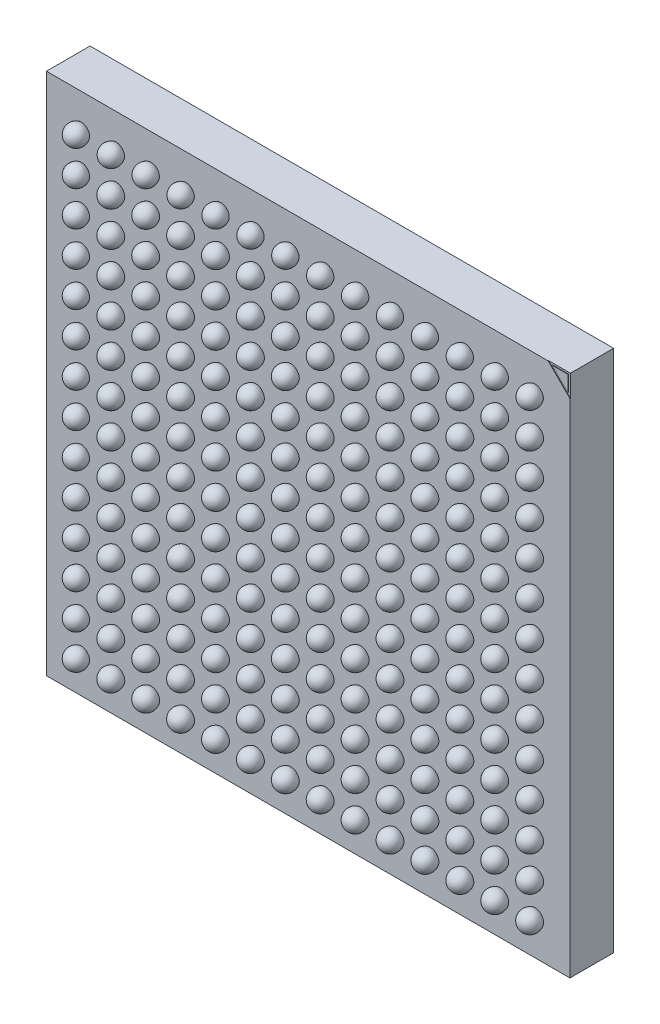
from build123d import *

# Parameters (mm, degrees)
SKETCH1_W            = 12
SKETCH1_H            = 12
BOSS_EXTRUDE1_DEPTH  = 1
LPATTERN1_COUNT      = 14
LPATTERN1_PITCH      = 0.8
LPATTERN2_COUNT      = 14
LPATTERN2_PITCH      = 0.8
LPATTERN3_COUNT      = 12
LPATTERN3_PITCH      = 0.8
LPATTERN4_COUNT      = 13
LPATTERN4_PITCH      = 0.8
LPATTERN5_COUNT      = 12
LPATTERN5_PITCH      = 0.8
LPATTERN6_COUNT      = 11
LPATTERN6_PITCH      = 0.8
LPATTERN7_COUNT      = 10
LPATTERN7_PITCH      = 0.8
LPATTERN7_COUNT_DIR2 = 10
LPATTERN7_PITCH_DIR2 = 0.8
BOSS_EXTRUDE2_DEPTH  = 0.01
BOSS_EXTRUDE3_DEPTH  = 0.01
CUT_EXTRUDE1_DEPTH   = 0.01
BOSS_EXTRUDE4_DEPTH  = 0.01


with BuildPart() as part:
    # Sketch1 → Boss-Extrude1 (new body)
    with BuildSketch(Plane.XY):
        Rectangle(SKETCH1_W, SKETCH1_H)
    extrude(amount=BOSS_EXTRUDE1_DEPTH)

    # Sketch3 → Revolve1 (revolve)
    with BuildSketch(Plane.XY.offset(1.12)):
        with BuildLine():
            Line((-5.2, 5.425), (-5.2, 4.975))
            ThreePointArc((-5.2, 4.975), (-5.425, 5.2), (-5.2, 5.425))
        make_face()
    revolve1 = revolve(axis=Axis((-5.2, 5.425, 1.12), (0, -1, 0)))

    # LPattern1: Revolve1 ×14
    with Locations(*[(i * LPATTERN1_PITCH, 0, 0) for i in range(1, LPATTERN1_COUNT)]):
        add(revolve1)

    # LPattern2: Revolve1 ×14
    with Locations(*[(0, -i * LPATTERN2_PITCH, 0) for i in range(1, LPATTERN2_COUNT)]):
        add(revolve1)

    # Sketch5 → Revolve2 (revolve)
    with BuildSketch(Plane.XY.offset(1.12)):
        with BuildLine():
            Line((5.2, 4.63), (5.2, 4.17))
            ThreePointArc((5.2, 4.17), (4.97, 4.4), (5.2, 4.63))
        make_face()
    revolve2 = revolve(axis=Axis((5.2, 5.2, 1.12), (0, -1, 0)))

    # LPattern3: Revolve2 ×12
    with Locations(*[(0, -i * LPATTERN3_PITCH, 0) for i in range(1, LPATTERN3_COUNT)]):
        add(revolve2)

    # Sketch8 → Revolve3 (revolve)
    with BuildSketch(Plane.XY.offset(1.12)):
        with BuildLine():
            Line((5.2, -4.972556486), (5.2, -5.432556486))
            ThreePointArc((5.2, -5.432556486), (5.43, -5.202556486), (5.2, -4.972556486))
        make_face()
    revolve3 = revolve(axis=Axis((5.2, -4.972556486, 1.12), (0, -1, 0)))

    # LPattern4: Revolve3 ×13
    with Locations(*[(-i * LPATTERN4_PITCH, 0, 0) for i in range(1, LPATTERN4_COUNT)]):
        add(revolve3)

    # Sketch9 → Revolve4 (revolve)
    with BuildSketch(Plane.XY.offset(1.12)):
        with BuildLine():
            Line((-4.4, 4.63), (-4.4, 4.17))
            ThreePointArc((-4.4, 4.17), (-4.17, 4.4), (-4.4, 4.63))
        make_face()
    revolve4 = revolve(axis=Axis((-4.4, 4.63, 1.12), (0, -1, 0)))

    # LPattern5: Revolve4 ×12
    with Locations(*[(i * LPATTERN5_PITCH, 0, 0) for i in range(1, LPATTERN5_COUNT)]):
        add(revolve4)

    # Mirror3: Revolve4 across plane
    add(revolve4.mirror(Plane.ZX))

    # Mirror3 copy 1 sketch → Mirror3 copy 1 (revolve)
    with BuildSketch(Plane(origin=(0.8, 0, 1.12), x_dir=(1, 0, 0), z_dir=(0, 0, 1))):
        with BuildLine():
            Line((-4.4, -4.63), (-4.4, -4.17))
            ThreePointArc((-4.4, -4.17), (-4.17, -4.4), (-4.4, -4.63))
        make_face()
    revolve(axis=Axis((-3.6, -4.63, 1.12), (0, -1, 0)))

    # Mirror3 copy 2 sketch → Mirror3 copy 2 (revolve)
    with BuildSketch(Plane(origin=(1.6, 0, 1.12), x_dir=(1, 0, 0), z_dir=(0, 0, 1))):
        with BuildLine():
            Line((-4.4, -4.63), (-4.4, -4.17))
            ThreePointArc((-4.4, -4.17), (-4.17, -4.4), (-4.4, -4.63))
        make_face()
    revolve(axis=Axis((-2.8, -4.63, 1.12), (0, -1, 0)))

    # Mirror3 copy 3 sketch → Mirror3 copy 3 (revolve)
    with BuildSketch(Plane(origin=(2.4, 0, 1.12), x_dir=(1, 0, 0), z_dir=(0, 0, 1))):
        with BuildLine():
            Line((-4.4, -4.63), (-4.4, -4.17))
            ThreePointArc((-4.4, -4.17), (-4.17, -4.4), (-4.4, -4.63))
        make_face()
    revolve(axis=Axis((-2, -4.63, 1.12), (0, -1, 0)))

    # Mirror3 copy 4 sketch → Mirror3 copy 4 (revolve)
    with BuildSketch(Plane(origin=(3.2, 0, 1.12), x_dir=(1, 0, 0), z_dir=(0, 0, 1))):
        with BuildLine():
            Line((-4.4, -4.63), (-4.4, -4.17))
            ThreePointArc((-4.4, -4.17), (-4.17, -4.4), (-4.4, -4.63))
        make_face()
    revolve(axis=Axis((-1.2, -4.63, 1.12), (0, -1, 0)))

    # Mirror3 copy 5 sketch → Mirror3 copy 5 (revolve)
    with BuildSketch(Plane(origin=(4, 0, 1.12), x_dir=(1, 0, 0), z_dir=(0, 0, 1))):
        with BuildLine():
            Line((-4.4, -4.63), (-4.4, -4.17))
            ThreePointArc((-4.4, -4.17), (-4.17, -4.4), (-4.4, -4.63))
        make_face()
    revolve(axis=Axis((-0.4, -4.63, 1.12), (0, -1, 0)))

    # Mirror3 copy 6 sketch → Mirror3 copy 6 (revolve)
    with BuildSketch(Plane(origin=(4.8, 0, 1.12), x_dir=(1, 0, 0), z_dir=(0, 0, 1))):
        with BuildLine():
            Line((-4.4, -4.63), (-4.4, -4.17))
            ThreePointArc((-4.4, -4.17), (-4.17, -4.4), (-4.4, -4.63))
        make_face()
    revolve(axis=Axis((0.4, -4.63, 1.12), (0, -1, 0)))

    # Mirror3 copy 7 sketch → Mirror3 copy 7 (revolve)
    with BuildSketch(Plane(origin=(5.6, 0, 1.12), x_dir=(1, 0, 0), z_dir=(0, 0, 1))):
        with BuildLine():
            Line((-4.4, -4.63), (-4.4, -4.17))
            ThreePointArc((-4.4, -4.17), (-4.17, -4.4), (-4.4, -4.63))
        make_face()
    revolve(axis=Axis((1.2, -4.63, 1.12), (0, -1, 0)))

    # Mirror3 copy 8 sketch → Mirror3 copy 8 (revolve)
    with BuildSketch(Plane(origin=(6.4, 0, 1.12), x_dir=(1, 0, 0), z_dir=(0, 0, 1))):
        with BuildLine():
            Line((-4.4, -4.63), (-4.4, -4.17))
            ThreePointArc((-4.4, -4.17), (-4.17, -4.4), (-4.4, -4.63))
        make_face()
    revolve(axis=Axis((2, -4.63, 1.12), (0, -1, 0)))

    # Mirror3 copy 9 sketch → Mirror3 copy 9 (revolve)
    with BuildSketch(Plane(origin=(7.2, 0, 1.12), x_dir=(1, 0, 0), z_dir=(0, 0, 1))):
        with BuildLine():
            Line((-4.4, -4.63), (-4.4, -4.17))
            ThreePointArc((-4.4, -4.17), (-4.17, -4.4), (-4.4, -4.63))
        make_face()
    revolve(axis=Axis((2.8, -4.63, 1.12), (0, -1, 0)))

    # Mirror3 copy 10 sketch → Mirror3 copy 10 (revolve)
    with BuildSketch(Plane(origin=(8, 0, 1.12), x_dir=(1, 0, 0), z_dir=(0, 0, 1))):
        with BuildLine():
            Line((-4.4, -4.63), (-4.4, -4.17))
            ThreePointArc((-4.4, -4.17), (-4.17, -4.4), (-4.4, -4.63))
        make_face()
    revolve(axis=Axis((3.6, -4.63, 1.12), (0, -1, 0)))

    # Mirror3 copy 11 sketch → Mirror3 copy 11 (revolve)
    with BuildSketch(Plane(origin=(8.8, 0, 1.12), x_dir=(1, 0, 0), z_dir=(0, 0, 1))):
        with BuildLine():
            Line((-4.4, -4.63), (-4.4, -4.17))
            ThreePointArc((-4.4, -4.17), (-4.17, -4.4), (-4.4, -4.63))
        make_face()
    revolve(axis=Axis((4.4, -4.63, 1.12), (0, -1, 0)))

    # LPattern6: Revolve4 ×11
    with Locations(*[(0, -i * LPATTERN6_PITCH, 0) for i in range(1, LPATTERN6_COUNT)]):
        add(revolve4)

    # Mirror4 copy 1 sketch → Mirror4 copy 1 (revolve)
    with BuildSketch(Plane(origin=(0, -0.8, 1.12), x_dir=(-1, 0, 0), z_dir=(0, 0, 1))):
        with BuildLine():
            Line((-4.4, -4.63), (-4.4, -4.17))
            ThreePointArc((-4.4, -4.17), (-4.17, -4.4), (-4.4, -4.63))
        make_face()
    revolve(axis=Axis((4.4, 3.83, 1.12), (0, 1, 0)))

    # Mirror4 copy 2 sketch → Mirror4 copy 2 (revolve)
    with BuildSketch(Plane(origin=(0, -1.6, 1.12), x_dir=(-1, 0, 0), z_dir=(0, 0, 1))):
        with BuildLine():
            Line((-4.4, -4.63), (-4.4, -4.17))
            ThreePointArc((-4.4, -4.17), (-4.17, -4.4), (-4.4, -4.63))
        make_face()
    revolve(axis=Axis((4.4, 3.03, 1.12), (0, 1, 0)))

    # Mirror4 copy 3 sketch → Mirror4 copy 3 (revolve)
    with BuildSketch(Plane(origin=(0, -2.4, 1.12), x_dir=(-1, 0, 0), z_dir=(0, 0, 1))):
        with BuildLine():
            Line((-4.4, -4.63), (-4.4, -4.17))
            ThreePointArc((-4.4, -4.17), (-4.17, -4.4), (-4.4, -4.63))
        make_face()
    revolve(axis=Axis((4.4, 2.23, 1.12), (0, 1, 0)))

    # Mirror4 copy 4 sketch → Mirror4 copy 4 (revolve)
    with BuildSketch(Plane(origin=(0, -3.2, 1.12), x_dir=(-1, 0, 0), z_dir=(0, 0, 1))):
        with BuildLine():
            Line((-4.4, -4.63), (-4.4, -4.17))
            ThreePointArc((-4.4, -4.17), (-4.17, -4.4), (-4.4, -4.63))
        make_face()
    revolve(axis=Axis((4.4, 1.43, 1.12), (0, 1, 0)))

    # Mirror4 copy 5 sketch → Mirror4 copy 5 (revolve)
    with BuildSketch(Plane(origin=(0, -4, 1.12), x_dir=(-1, 0, 0), z_dir=(0, 0, 1))):
        with BuildLine():
            Line((-4.4, -4.63), (-4.4, -4.17))
            ThreePointArc((-4.4, -4.17), (-4.17, -4.4), (-4.4, -4.63))
        make_face()
    revolve(axis=Axis((4.4, 0.63, 1.12), (0, 1, 0)))

    # Mirror4 copy 6 sketch → Mirror4 copy 6 (revolve)
    with BuildSketch(Plane(origin=(0, -4.8, 1.12), x_dir=(-1, 0, 0), z_dir=(0, 0, 1))):
        with BuildLine():
            Line((-4.4, -4.63), (-4.4, -4.17))
            ThreePointArc((-4.4, -4.17), (-4.17, -4.4), (-4.4, -4.63))
        make_face()
    revolve(axis=Axis((4.4, -0.17, 1.12), (0, 1, 0)))

    # Mirror4 copy 7 sketch → Mirror4 copy 7 (revolve)
    with BuildSketch(Plane(origin=(0, -5.6, 1.12), x_dir=(-1, 0, 0), z_dir=(0, 0, 1))):
        with BuildLine():
            Line((-4.4, -4.63), (-4.4, -4.17))
            ThreePointArc((-4.4, -4.17), (-4.17, -4.4), (-4.4, -4.63))
        make_face()
    revolve(axis=Axis((4.4, -0.97, 1.12), (0, 1, 0)))

    # Mirror4 copy 8 sketch → Mirror4 copy 8 (revolve)
    with BuildSketch(Plane(origin=(0, -6.4, 1.12), x_dir=(-1, 0, 0), z_dir=(0, 0, 1))):
        with BuildLine():
            Line((-4.4, -4.63), (-4.4, -4.17))
            ThreePointArc((-4.4, -4.17), (-4.17, -4.4), (-4.4, -4.63))
        make_face()
    revolve(axis=Axis((4.4, -1.77, 1.12), (0, 1, 0)))

    # Mirror4 copy 9 sketch → Mirror4 copy 9 (revolve)
    with BuildSketch(Plane(origin=(0, -7.2, 1.12), x_dir=(-1, 0, 0), z_dir=(0, 0, 1))):
        with BuildLine():
            Line((-4.4, -4.63), (-4.4, -4.17))
            ThreePointArc((-4.4, -4.17), (-4.17, -4.4), (-4.4, -4.63))
        make_face()
    revolve(axis=Axis((4.4, -2.57, 1.12), (0, 1, 0)))

    # Mirror4 copy 10 sketch → Mirror4 copy 10 (revolve)
    with BuildSketch(Plane(origin=(0, -8, 1.12), x_dir=(-1, 0, 0), z_dir=(0, 0, 1))):
        with BuildLine():
            Line((-4.4, -4.63), (-4.4, -4.17))
            ThreePointArc((-4.4, -4.17), (-4.17, -4.4), (-4.4, -4.63))
        make_face()
    revolve(axis=Axis((4.4, -3.37, 1.12), (0, 1, 0)))

    # Mirror4 copy 11 sketch → Mirror4 copy 11 (revolve)
    with BuildSketch(Plane(origin=(0, 0, 1.12), x_dir=(-1, 0, 0), z_dir=(0, 0, 1))):
        with BuildLine():
            Line((-4.4, -4.63), (-4.4, -4.17))
            ThreePointArc((-4.4, -4.17), (-4.17, -4.4), (-4.4, -4.63))
        make_face()
    revolve(axis=Axis((4.4, 4.63, 1.12), (0, 1, 0)))

    # Sketch10 → Revolve5 (revolve)
    with BuildSketch(Plane.XY.offset(1.12)):
        with BuildLine():
            Line((-3.6, 3.83), (-3.6, 3.37))
            ThreePointArc((-3.6, 3.37), (-3.83, 3.6), (-3.6, 3.83))
        make_face()
    revolve5 = revolve(axis=Axis((-3.6, 3.83, 1.12), (0, -1, 0)))

    # LPattern7: Revolve5 10 × 10
    with Locations(*[(i * LPATTERN7_PITCH, -j * LPATTERN7_PITCH_DIR2, 0) for i in range(LPATTERN7_COUNT) for j in range(LPATTERN7_COUNT_DIR2) if (i, j) != (0, 0)]):
        add(revolve5)

    # Sketch11 → Boss-Extrude2 (add)
    # profile 1 of 2: a face of its own
    with BuildSketch(Plane(origin=(0, 0, 0), x_dir=(-1, 0, 0), z_dir=(0, 0, -1))):
        with BuildLine():
            Line((-4.383850212, 0.87976633), (-4.383850212, 4.310264847))
            Line((-4.383850212, 4.310264847), (-3.29335538, 4.310264847))
            Line((-3.29335538, 4.310264847), (-1.699193609, 2.507481058))
            Line((-1.699193609, 2.507481058), (-1.699193609, 4.310264847))
            Line((-1.699193609, 4.310264847), (-0.340536036, 4.310264847))
            Line((-0.340536036, 4.310264847), (0.283707933, 3.303879896))
            Line((0.283707933, 3.303879896), (0.905288203, 4.310264847))
            Line((0.905288203, 4.310264847), (3.996249009, 4.310264847))
            ThreePointArc((3.996249009, 4.310264847), (4.420513078, 4.134528915), (4.596249009, 3.710264847))
            Line((4.596249009, 3.710264847), (4.596249009, 2.778053424))
            ThreePointArc((4.596249009, 2.778053424), (4.420513078, 2.353789355), (3.996249009, 2.178053424))
            Line((3.996249009, 2.178053424), (2.328850088, 2.178053424))
            Line((2.328850088, 2.178053424), (2.328850088, 0.844626446))
            Line((2.328850088, 0.844626446), (0.905288203, 0.844626446))
            Line((0.905288203, 0.844626446), (0.283707933, 1.846717072))
            Line((0.283707933, 1.846717072), (-0.324294808, 0.862315154))
            Line((-0.324294808, 0.862315154), (-1.585887652, 0.862315154))
            Line((-1.585887652, 0.862315154), (-3.219751476, 2.709996656))
            Line((-3.219751476, 2.709996656), (-3.219751476, 0.87976633))
            Line((-3.219751476, 0.87976633), (-4.383850212, 0.87976633))
        make_face()
        Polygon((-4.219704391, 1.045144765), (-4.219704391, 4.114773531), (-3.322697893, 4.114773531), (-1.495738313, 1.992381752), (-1.495738313, 3.900233946), (-0.680566666, 2.594058204), (-1.59427424, 1.073528346), (-3.375117038, 3.142345934), (-3.375117038, 1.045144765), align=None, mode=Mode.SUBTRACT)
        Polygon((-1.445224228, 4.150363705), (-0.430793897, 4.150363705), (0.294524128, 2.989356236), (0.990555559, 4.150363705), (2.003154175, 4.150363705), (1.060414542, 2.577837373), (2.035310731, 1.017333266), (1.029352181, 1.017333266), (0.294524128, 2.193563318), (-0.404596433, 1.027403062), (-1.445224228, 1.027403062), (-0.458796817, 2.594058204), align=None, mode=Mode.SUBTRACT)
        with BuildLine():
            Line((2.21981642, 4.150363705), (3.859234326, 4.127386313))
            ThreePointArc((3.859234326, 4.127386313), (4.280993931, 3.945721917), (4.450766882, 3.519036714))
            Line((4.450766882, 3.519036714), (4.442189322, 2.907034951))
            ThreePointArc((4.442189322, 2.907034951), (4.263528963, 2.488216886), (3.842248245, 2.315443472))
            Line((3.842248245, 2.315443472), (2.152608039, 2.315443472))
            Line((2.152608039, 2.315443472), (2.152608039, 1.109618447))
            Line((2.152608039, 1.109618447), (1.267354651, 2.577837373))
            Line((1.267354651, 2.577837373), (2.21981642, 4.150363705))
        make_face(mode=Mode.SUBTRACT)
    # profile 2 of 2: a face of its own
    with BuildSketch(Plane(origin=(0, 0, 0), x_dir=(-1, 0, 0), z_dir=(0, 0, -1))):
        with BuildLine():
            Line((2.152608039, 3.693985443), (3.707065203, 3.693985443))
            ThreePointArc((3.707065203, 3.693985443), (3.848486559, 3.635406799), (3.907065203, 3.493985443))
            Line((3.907065203, 3.493985443), (3.907065203, 2.978053424))
            ThreePointArc((3.907065203, 2.978053424), (3.848486559, 2.836632068), (3.707065203, 2.778053424))
            Line((3.707065203, 2.778053424), (2.152608039, 2.778053424))
            Line((2.152608039, 2.778053424), (2.152608039, 3.693985443))
        make_face()
        with BuildLine():
            Line((2.313280362, 3.527993081), (3.520235623, 3.527993081))
            ThreePointArc((3.520235623, 3.527993081), (3.661656979, 3.469414438), (3.720235623, 3.327993081))
            Line((3.720235623, 3.327993081), (3.720235623, 3.154921786))
            ThreePointArc((3.720235623, 3.154921786), (3.661656979, 3.01350043), (3.520235623, 2.954921786))
            Line((3.520235623, 2.954921786), (2.313280362, 2.954921786))
            Line((2.313280362, 2.954921786), (2.313280362, 3.527993081))
        make_face(mode=Mode.SUBTRACT)
    extrude(amount=BOSS_EXTRUDE2_DEPTH)

    # Sketch12 → Boss-Extrude3 (add)
    # profile 1 of 7: a face of its own
    with BuildSketch(Plane(origin=(0, 0, 0), x_dir=(-1, 0, 0), z_dir=(0, 0, -1))):
        with BuildLine():
            Line((-2.389935631, -3.291769219), (-2.550993323, -3.439124989))
            add(Edge.make_bspline(
                [(-2.550993323, -3.439124989), (-2.557892344, -3.429393202), (-2.571137502, -3.41070953), (-2.592606522, -3.385691652), (-2.613978598, -3.36434954), (-2.63545173, -3.346772353), (-2.657216247, -3.333066883), (-2.679234369, -3.323363259), (-2.70138127, -3.317194573), (-2.716260569, -3.316426423), (-2.723589477, -3.316048066)],
                knots=[0, 0, 0, 0, 1.299362458, 2.494594718, 3.587462134, 4.587049575, 5.512617175, 6.380583204, 7.202344345, 8, 8, 8, 8], degree=3))
            add(Edge.make_bspline(
                [(-2.723589477, -3.316048066), (-2.730425672, -3.31628781), (-2.743624569, -3.316750695), (-2.762440575, -3.321351731), (-2.779145694, -3.329292444), (-2.793723621, -3.339675594), (-2.80527149, -3.352184882), (-2.814491568, -3.36530391), (-2.819683247, -3.379784349), (-2.820366574, -3.389730099), (-2.820704861, -3.394653835)],
                knots=[0, 0, 0, 0, 1.185010067, 2.2879431, 3.333075148, 4.379039566, 5.372662701, 6.27520591, 7.14612461, 8, 8, 8, 8], degree=3))
            add(Edge.make_bspline(
                [(-2.820704861, -3.394653835), (-2.820492874, -3.399648573), (-2.82006596, -3.409707283), (-2.815942557, -3.424449574), (-2.80972741, -3.438854509), (-2.803788584, -3.447623478), (-2.800752938, -3.452105758)],
                knots=[0, 0, 0, 0, 0.967525499, 1.948461899, 2.951351359, 4, 4, 4, 4], degree=3))
            add(Edge.make_bspline(
                [(-2.800752938, -3.452105758), (-2.797993208, -3.455589787), (-2.791640674, -3.463609562), (-2.779527693, -3.476311635), (-2.764316332, -3.491872787), (-2.745421227, -3.509757915), (-2.723626765, -3.530610238), (-2.697922745, -3.553610043), (-2.66904904, -3.579469608), (-2.64852628, -3.597477272), (-2.637772169, -3.60691345)],
                knots=[0, 0, 0, 0, 0.473873513, 1.090794244, 1.870441696, 2.795289791, 3.865433203, 5.087734844, 6.473946851, 8, 8, 8, 8], degree=3))
            add(Edge.make_bspline(
                [(-2.637772169, -3.60691345), (-2.627677889, -3.61564954), (-2.608521042, -3.632228825), (-2.581264654, -3.655760457), (-2.557310828, -3.676931293), (-2.536310612, -3.695423603), (-2.518582349, -3.711431415), (-2.504051508, -3.725031245), (-2.492540622, -3.73595833), (-2.485997356, -3.742558295), (-2.483204861, -3.745374989)],
                knots=[0, 0, 0, 0, 1.543621617, 2.929473131, 4.163658386, 5.240097082, 6.164993805, 6.925417477, 7.541396219, 8, 8, 8, 8], degree=3))
            add(Edge.make_bspline(
                [(-2.483204861, -3.745374989), (-2.472610718, -3.756840121), (-2.452245054, -3.778880131), (-2.425776871, -3.813035214), (-2.4039927, -3.846377541), (-2.387140052, -3.879534499), (-2.374412254, -3.912984479), (-2.365438988, -3.947547839), (-2.360064839, -3.983585745), (-2.359468183, -4.008177216), (-2.3591664, -4.020615373)],
                knots=[0, 0, 0, 0, 1.206664779, 2.319633467, 3.337109185, 4.282041471, 5.190008762, 6.099243693, 7.03861361, 8, 8, 8, 8], degree=3))
            add(Edge.make_bspline(
                [(-2.3591664, -4.020615373), (-2.359381202, -4.032734832), (-2.359802651, -4.056513661), (-2.364964594, -4.091310436), (-2.372325222, -4.124612459), (-2.383706044, -4.156057358), (-2.397576923, -4.186161292), (-2.414966073, -4.214455336), (-2.435387245, -4.241225838), (-2.458793044, -4.265994243), (-2.484682636, -4.288469853), (-2.512451685, -4.308478172), (-2.542371729, -4.324997588), (-2.574187137, -4.338600149), (-2.607880878, -4.349077024), (-2.643412814, -4.35682041), (-2.680837292, -4.361467869), (-2.706428689, -4.361953705), (-2.719502938, -4.362201912)],
                knots=[0, 0, 0, 0, 1.043214005, 2.046824704, 3.02475056, 3.976699089, 4.921714032, 5.875962561, 6.831408892, 7.817874052, 8.806269674, 9.781291748, 10.760897367, 11.74438705, 12.757449933, 13.795994037, 14.874007457, 16, 16, 16, 16], degree=3))
            add(Edge.make_bspline(
                [(-2.719502938, -4.362201912), (-2.729766112, -4.362019836), (-2.750093083, -4.361659222), (-2.780051965, -4.358715109), (-2.808980652, -4.353963624), (-2.836846558, -4.347153326), (-2.863775225, -4.338523754), (-2.889767759, -4.327983064), (-2.914644724, -4.315367877), (-2.938594351, -4.300937612), (-2.961500215, -4.284182174), (-2.983651953, -4.265444122), (-3.004829532, -4.244435257), (-3.025134663, -4.221205263), (-3.044437429, -4.195688359), (-3.063369679, -4.168239914), (-3.081090006, -4.138350524), (-3.092036641, -4.117382875), (-3.097627938, -4.106673066)],
                knots=[0, 0, 0, 0, 1.016823716, 2.013894106, 2.979844003, 3.91962641, 4.853723003, 5.779685073, 6.695824784, 7.614987388, 8.547259901, 9.504950863, 10.487499108, 11.500346958, 12.559593716, 13.656357062, 14.802919212, 16, 16, 16, 16], degree=3))
            Line((-3.097627938, -4.106673066), (-2.908204861, -3.992971142))
            add(Edge.make_bspline(
                [(-2.908204861, -3.992971142), (-2.901210984, -4.005128176), (-2.887803122, -4.028434248), (-2.865082247, -4.059748909), (-2.84180587, -4.086564733), (-2.817435863, -4.108407748), (-2.792268555, -4.125570024), (-2.766182384, -4.137835376), (-2.73915902, -4.145427616), (-2.720751932, -4.146354803), (-2.711570246, -4.146817296)],
                knots=[0, 0, 0, 0, 1.283663364, 2.460892379, 3.537111102, 4.529833553, 5.449777664, 6.316464042, 7.160231139, 8, 8, 8, 8], degree=3))
            add(Edge.make_bspline(
                [(-2.711570246, -4.146817296), (-2.702231157, -4.1464396), (-2.684111963, -4.145706813), (-2.658249132, -4.138938282), (-2.63453711, -4.128311193), (-2.614040613, -4.113147802), (-2.596685472, -4.095646944), (-2.583876382, -4.076176439), (-2.575829625, -4.055109823), (-2.574978887, -4.040475566), (-2.574551015, -4.033115373)],
                knots=[0, 0, 0, 0, 1.13588714, 2.203786484, 3.234766741, 4.283437687, 5.291419208, 6.222934724, 7.106237994, 8, 8, 8, 8], degree=3))
            add(Edge.make_bspline(
                [(-2.574551015, -4.033115373), (-2.574946138, -4.026267912), (-2.575748791, -4.012357949), (-2.581660888, -3.991676071), (-2.590903299, -3.971003598), (-2.601837722, -3.954047477), (-2.612964867, -3.939850576), (-2.623604928, -3.927549604), (-2.636561707, -3.913959183), (-2.651802352, -3.899062218), (-2.669125494, -3.882727567), (-2.688545726, -3.86495683), (-2.710285429, -3.845906545), (-2.725651095, -3.832929679), (-2.733685631, -3.826144219)],
                knots=[0, 0, 0, 0, 0.916159276, 1.861089862, 2.860218735, 3.940849679, 4.552606315, 5.27541173, 6.11797699, 7.06649574, 8.129236253, 9.306560635, 10.591630461, 12, 12, 12, 12], degree=3))
            add(Edge.make_bspline(
                [(-2.733685631, -3.826144219), (-2.748959603, -3.813220974), (-2.778274979, -3.788417355), (-2.819701325, -3.751783189), (-2.857030172, -3.717545205), (-2.889939108, -3.685280146), (-2.918847444, -3.655583872), (-2.9435594, -3.62821518), (-2.963803503, -3.602962956), (-2.985106057, -3.573053387), (-3.005347743, -3.536606523), (-3.022842303, -3.492756719), (-3.034192035, -3.448912479), (-3.035463615, -3.419477872), (-3.036089477, -3.404990373)],
                knots=[0, 0, 0, 0, 1.345494975, 2.582412109, 3.71882943, 4.751509156, 5.681369928, 6.505683931, 7.230279997, 7.856715994, 8.973648664, 10.023341002, 11.027102913, 12, 12, 12, 12], degree=3))
            add(Edge.make_bspline(
                [(-3.036089477, -3.404990373), (-3.035829182, -3.394716617), (-3.035316372, -3.374476214), (-3.030742031, -3.34471565), (-3.023905505, -3.315999206), (-3.013976905, -3.288431653), (-3.001090782, -3.262047521), (-2.985441086, -3.236717647), (-2.966784807, -3.212675164), (-2.94576044, -3.189936008), (-2.922596971, -3.169155007), (-2.89784386, -3.150813692), (-2.871641213, -3.13532235), (-2.844149324, -3.122471157), (-2.815197836, -3.112634385), (-2.785000036, -3.105661591), (-2.753512609, -3.101514396), (-2.73209554, -3.100950633), (-2.721185631, -3.10066345)],
                knots=[0, 0, 0, 0, 1.010766082, 1.991317756, 2.957454644, 3.913069143, 4.869106762, 5.843196583, 6.838735724, 7.860187025, 8.887984031, 9.89767229, 10.887916223, 11.879572884, 12.879850636, 13.892031539, 14.926195476, 16, 16, 16, 16], degree=3))
            add(Edge.make_bspline(
                [(-2.721185631, -3.10066345), (-2.707046928, -3.101180674), (-2.678881129, -3.102211039), (-2.637237182, -3.110268156), (-2.596561116, -3.122938822), (-2.56378358, -3.138224585), (-2.537703107, -3.153031912), (-2.51771486, -3.166664633), (-2.497375743, -3.182281648), (-2.476521733, -3.19993217), (-2.45554033, -3.219948758), (-2.433834934, -3.241854901), (-2.411701305, -3.26583992), (-2.397317956, -3.282974706), (-2.389935631, -3.291769219)],
                knots=[0, 0, 0, 0, 1.282922637, 2.555718331, 3.837320111, 5.142675274, 5.830281639, 6.55870424, 7.337177975, 8.157850921, 9.037902056, 9.96903443, 10.957596896, 12, 12, 12, 12], degree=3))
        make_face()
    # profile 2 of 7: a face of its own
    with BuildSketch(Plane(origin=(0, 0, 0), x_dir=(-1, 0, 0), z_dir=(0, 0, -1))):
        with BuildLine():
            Line((-1.836089477, -3.131432681), (-1.620704861, -3.131432681))
            Line((-1.620704861, -3.131432681), (-1.620704861, -3.928067296))
            add(Edge.make_bspline(
                [(-1.620704861, -3.928067296), (-1.620783828, -3.943293138), (-1.620935981, -3.972630329), (-1.6224593, -4.014865055), (-1.624519096, -4.053587995), (-1.627485402, -4.088737103), (-1.631891177, -4.12031068), (-1.636877178, -4.148387498), (-1.64237812, -4.173081962), (-1.651670561, -4.20071891), (-1.666096807, -4.231323686), (-1.687866424, -4.264381193), (-1.714976565, -4.293102533), (-1.746198493, -4.318050337), (-1.781795275, -4.337804279), (-1.820946846, -4.352082481), (-1.863528046, -4.360612377), (-1.893020882, -4.361661688), (-1.908204861, -4.362201912)],
                knots=[0, 0, 0, 0, 1.22248561, 2.355488409, 3.392943897, 4.335991845, 5.186735882, 5.951517034, 6.625683685, 7.215700098, 8.28923535, 9.333114649, 10.380102123, 11.447198135, 12.530158036, 13.633358744, 14.781567393, 16, 16, 16, 16], degree=3))
            add(Edge.make_bspline(
                [(-1.908204861, -4.362201912), (-1.924025187, -4.361712133), (-1.955229045, -4.360746097), (-2.000992718, -4.352517955), (-2.044977328, -4.339325767), (-2.086955323, -4.320251447), (-2.127501813, -4.296358283), (-2.165880917, -4.26672114), (-2.202893937, -4.232259194), (-2.224835482, -4.205813961), (-2.236089477, -4.192249989)],
                knots=[0, 0, 0, 0, 0.990984786, 1.954608977, 2.90473533, 3.862451285, 4.837525908, 5.848096122, 6.896271184, 8, 8, 8, 8], degree=3))
            Line((-2.236089477, -4.192249989), (-2.073108708, -4.041528835))
            add(Edge.make_bspline(
                [(-2.073108708, -4.041528835), (-2.064575219, -4.051177801), (-2.048606766, -4.069233611), (-2.024542779, -4.092778831), (-2.002835767, -4.111694697), (-1.982373239, -4.125338882), (-1.963063242, -4.134956509), (-1.944490308, -4.141884356), (-1.926075493, -4.145805911), (-1.913910104, -4.146485271), (-1.907964477, -4.146817296)],
                knots=[0, 0, 0, 0, 1.529509877, 2.862124173, 3.996688592, 4.944357383, 5.774364335, 6.554177287, 7.293378699, 8, 8, 8, 8], degree=3))
            add(Edge.make_bspline(
                [(-1.907964477, -4.146817296), (-1.902209772, -4.146517198), (-1.891145365, -4.145940207), (-1.875931382, -4.139526221), (-1.863105015, -4.129455993), (-1.854660892, -4.117878959), (-1.849279751, -4.106044114), (-1.845917513, -4.094603917), (-1.842726743, -4.080890222), (-1.840170369, -4.064909901), (-1.838238769, -4.046454513), (-1.837276005, -4.025748106), (-1.836105162, -4.002678785), (-1.836094891, -3.986562862), (-1.836089477, -3.978067296)],
                knots=[0, 0, 0, 0, 1.003927327, 1.930222208, 2.840933547, 3.835773585, 4.407906147, 5.114514582, 5.922289074, 6.876303333, 7.950072246, 9.174518422, 10.510537432, 12, 12, 12, 12], degree=3))
            Line((-1.836089477, -3.978067296), (-1.836089477, -3.131432681))
        make_face()
    # profile 3 of 7: a face of its own
    with BuildSketch(Plane(origin=(0, 0, 0), x_dir=(-1, 0, 0), z_dir=(0, 0, -1))):
        Polygon((-0.974310631, -3.131432681), (-0.774551015, -3.131432681), (-0.289935631, -4.331432681), (-0.519983708, -4.331432681), (-0.613252938, -4.085278835), (-1.136089477, -4.085278835), (-1.229358708, -4.331432681), (-1.4591664, -4.331432681), align=None)
        Polygon((-0.874551015, -3.453307681), (-1.054358708, -3.869894219), (-0.694743323, -3.869894219), align=None, mode=Mode.SUBTRACT)
    # profile 4 of 7: a face of its own
    with BuildSketch(Plane(origin=(0, 0, 0), x_dir=(-1, 0, 0), z_dir=(0, 0, -1))):
        Polygon((0.015593215, -3.131432681), (0.348525908, -3.131432681), (0.348525908, -4.331432681), (0.133141292, -4.331432681), (0.133141292, -3.331432681), (-0.113012554, -3.331432681), align=None)
    # profile 5 of 7: a face of its own
    with BuildSketch(Plane(origin=(0, 0, 0), x_dir=(-1, 0, 0), z_dir=(0, 0, -1))):
        Polygon((0.938670139, -3.131432681), (1.271602831, -3.131432681), (1.271602831, -4.331432681), (1.056218215, -4.331432681), (1.056218215, -3.331432681), (0.810064369, -3.331432681), align=None)
    # profile 6 of 7: a face of its own
    with BuildSketch(Plane(origin=(0, 0, 0), x_dir=(-1, 0, 0), z_dir=(0, 0, -1))):
        Polygon((1.861747062, -3.131432681), (2.194679754, -3.131432681), (2.194679754, -4.331432681), (1.979295139, -4.331432681), (1.979295139, -3.331432681), (1.733141292, -3.331432681), align=None)
    # profile 7 of 7: a face of its own
    with BuildSketch(Plane(origin=(0, 0, 0), x_dir=(-1, 0, 0), z_dir=(0, 0, -1))):
        with BuildLine():
            add(Edge.make_bspline(
                [(2.967997062, -3.10066345), (2.978422571, -3.10081822), (2.998921908, -3.101122538), (3.029113572, -3.104418555), (3.058196493, -3.109397916), (3.086284445, -3.11634239), (3.113175249, -3.125533153), (3.139064622, -3.136534338), (3.163644405, -3.149922982), (3.18722807, -3.165046142), (3.209806531, -3.182167704), (3.230837131, -3.201687168), (3.250703934, -3.223155391), (3.268976896, -3.246896934), (3.286060678, -3.272695842), (3.301899145, -3.300556207), (3.316371051, -3.330614386), (3.329638589, -3.362924621), (3.341502464, -3.39797123), (3.351495392, -3.436156211), (3.360065999, -3.477488286), (3.367300196, -3.522070335), (3.37276808, -3.569961619), (3.376453544, -3.621130322), (3.378982683, -3.675477797), (3.379189094, -3.712759719), (3.379295139, -3.73191345)],
                knots=[0, 0, 0, 0, 0.879237366, 1.728815576, 2.559023295, 3.367336655, 4.166867292, 4.954216142, 5.737608147, 6.525189134, 7.316157332, 8.124696809, 8.942788509, 9.781158001, 10.649253743, 11.551476218, 12.482711956, 13.461909668, 14.496590415, 15.601789533, 16.789733467, 18.056700938, 19.410929216, 20.8549011, 22.384193279, 24, 24, 24, 24], degree=3))
            add(Edge.make_bspline(
                [(3.379295139, -3.73191345), (3.379180533, -3.751306816), (3.378957857, -3.788987779), (3.376558681, -3.843832344), (3.372427186, -3.895372562), (3.367102216, -3.943603101), (3.359808465, -3.988498491), (3.351266468, -4.030174982), (3.341115806, -4.068617466), (3.328861138, -4.103739324), (3.315673908, -4.136106303), (3.301162416, -4.166105876), (3.285579595, -4.193819297), (3.269282868, -4.219664662), (3.251378789, -4.242880062), (3.232738799, -4.264254942), (3.212551281, -4.282975106), (3.191666206, -4.300005307), (3.16931847, -4.314722818), (3.145738539, -4.32759451), (3.120506025, -4.338034981), (3.094080872, -4.347115545), (3.066012659, -4.353634411), (3.036747386, -4.358806916), (3.005954654, -4.36166556), (2.984989722, -4.362020194), (2.974247062, -4.362201912)],
                knots=[0, 0, 0, 0, 1.643780988, 3.193836972, 4.651895693, 6.025988579, 7.305620092, 8.505800249, 9.631074763, 10.672816429, 11.65661981, 12.592235626, 13.49536222, 14.350718032, 15.179365177, 15.97804903, 16.751647189, 17.51006938, 18.259804725, 19.016521909, 19.783502495, 20.571750527, 21.382245291, 22.22305063, 23.089471752, 24, 24, 24, 24], degree=3))
            add(Edge.make_bspline(
                [(2.974247062, -4.362201912), (2.963504691, -4.362016688), (2.942460546, -4.361653839), (2.911584548, -4.358828171), (2.882164183, -4.353613457), (2.853873906, -4.347065498), (2.826910611, -4.338055073), (2.80114501, -4.32730223), (2.776775219, -4.314510851), (2.753733762, -4.299759049), (2.732099308, -4.282842794), (2.711535658, -4.263943022), (2.692088301, -4.243107641), (2.674053078, -4.220103276), (2.657134626, -4.195236988), (2.641509376, -4.168224816), (2.627186719, -4.139106088), (2.61371864, -4.107840218), (2.602016584, -4.073754085), (2.591602298, -4.036543306), (2.583071189, -3.995897698), (2.576209899, -3.951830318), (2.57073185, -3.904434526), (2.566656811, -3.853687445), (2.564244308, -3.799565437), (2.564023968, -3.762364685), (2.563910523, -3.743211527)],
                knots=[0, 0, 0, 0, 0.917216111, 1.796812873, 2.643793957, 3.46689424, 4.273913431, 5.068098542, 5.848489301, 6.620921603, 7.401012384, 8.190319798, 9.003608147, 9.831726257, 10.68377682, 11.569763213, 12.493818149, 13.453288342, 14.474581811, 15.568529029, 16.750744269, 18.018426408, 19.375425659, 20.823733699, 22.36466933, 24, 24, 24, 24], degree=3))
            add(Edge.make_bspline(
                [(2.563910523, -3.743211527), (2.564116017, -3.716599722), (2.564512521, -3.665251901), (2.569537305, -3.591069229), (2.576912414, -3.522500199), (2.587744701, -3.45965951), (2.601138675, -3.402314419), (2.618290356, -3.350842684), (2.637816297, -3.30453208), (2.654454907, -3.2770974), (2.662468215, -3.263884604)],
                knots=[0, 0, 0, 0, 1.288568992, 2.486310467, 3.599230591, 4.627010532, 5.572937695, 6.447898582, 7.252493626, 8, 8, 8, 8], degree=3))
            add(Edge.make_bspline(
                [(2.662468215, -3.263884604), (2.671785709, -3.250904358), (2.690003244, -3.225525419), (2.721857114, -3.192207616), (2.756079949, -3.163712599), (2.793374668, -3.140685236), (2.833151439, -3.122525856), (2.875751766, -3.109700091), (2.921018333, -3.102227202), (2.95210364, -3.101192485), (2.967997062, -3.10066345)],
                knots=[0, 0, 0, 0, 1.058512271, 2.069600068, 3.047294572, 4.004278952, 4.967380941, 5.939006123, 6.946246673, 8, 8, 8, 8], degree=3))
        make_face()
        with BuildLine():
            add(Edge.make_bspline(
                [(2.973285523, -3.316048066), (2.963860776, -3.31649478), (2.945383269, -3.317370577), (2.918571527, -3.324804859), (2.893289727, -3.336287507), (2.874058537, -3.35010508), (2.859664183, -3.36335088), (2.849606745, -3.375337899), (2.839907931, -3.388714548), (2.831341449, -3.404084446), (2.823252455, -3.420895336), (2.815347069, -3.439223527), (2.808866729, -3.459519202), (2.802499966, -3.48143672), (2.796922088, -3.505582045), (2.792249049, -3.532152536), (2.788074099, -3.561320985), (2.785162022, -3.593106496), (2.782447092, -3.627475815), (2.780500902, -3.664505502), (2.779687249, -3.704185569), (2.779428613, -3.731512642), (2.779295139, -3.745615373)],
                knots=[0, 0, 0, 0, 1.076674018, 2.110852608, 3.161083442, 4.239746716, 4.804137807, 5.395870207, 6.026861976, 6.692161227, 7.405688833, 8.16177676, 8.973626916, 9.841385931, 10.773283133, 11.807421078, 12.927755683, 14.143907515, 15.458935494, 16.872852025, 18.386167141, 20, 20, 20, 20], degree=3))
            add(Edge.make_bspline(
                [(2.779295139, -3.745615373), (2.779514821, -3.763886144), (2.77993608, -3.798921701), (2.782142434, -3.849304051), (2.786564887, -3.895156047), (2.792065526, -3.936788445), (2.799791399, -3.973931246), (2.808680515, -4.006935857), (2.819657783, -4.035381548), (2.832344132, -4.059679709), (2.846394834, -4.080350105), (2.86164749, -4.097920033), (2.877582801, -4.113134763), (2.894698159, -4.1254935), (2.912952733, -4.134964667), (2.932194131, -4.14177716), (2.95243458, -4.145947371), (2.96629503, -4.146525645), (2.973285523, -4.146817296)],
                knots=[0, 0, 0, 0, 1.771748488, 3.397459088, 4.888034009, 6.237357457, 7.467047327, 8.564189669, 9.548206622, 10.417051504, 11.216568818, 11.965764335, 12.669334354, 13.348544111, 14.005342236, 14.656555988, 15.322436492, 16, 16, 16, 16], degree=3))
            add(Edge.make_bspline(
                [(2.973285523, -4.146817296), (2.980036124, -4.146617727), (2.993252962, -4.146226994), (3.012526071, -4.142216177), (3.030752093, -4.13569546), (3.047875997, -4.126471448), (3.063959033, -4.114741706), (3.078922597, -4.100454687), (3.092653837, -4.083467984), (3.10065372, -4.070861338), (3.104775908, -4.064365373)],
                knots=[0, 0, 0, 0, 0.992283464, 1.942767638, 2.88273346, 3.832339453, 4.79467288, 5.803907806, 6.868395428, 8, 8, 8, 8], degree=3))
            add(Edge.make_bspline(
                [(3.104775908, -4.064365373), (3.109629089, -4.055488845), (3.119805818, -4.036875484), (3.131582345, -4.005466132), (3.14149517, -3.970041574), (3.150026993, -3.930491566), (3.15586224, -3.886660117), (3.160887547, -3.838825167), (3.163311377, -3.786745838), (3.163705627, -3.750665091), (3.163910523, -3.73191345)],
                knots=[0, 0, 0, 0, 0.710965849, 1.490837728, 2.352621235, 3.297892224, 4.334225155, 5.461620853, 6.680770821, 8, 8, 8, 8], degree=3))
            add(Edge.make_bspline(
                [(3.163910523, -3.73191345), (3.163831376, -3.712999036), (3.163679031, -3.676592017), (3.160883948, -3.624325459), (3.15699158, -3.576588633), (3.151298171, -3.533488115), (3.143972564, -3.494919277), (3.134943726, -3.46088464), (3.124299398, -3.431317127), (3.111676494, -3.406246222), (3.097695843, -3.384939392), (3.082854955, -3.366659785), (3.067091077, -3.351053117), (3.050430571, -3.338060659), (3.032487824, -3.328133446), (3.013605566, -3.321124013), (2.993745087, -3.316883541), (2.980197429, -3.316330316), (2.973285523, -3.316048066)],
                knots=[0, 0, 0, 0, 1.793836731, 3.452829483, 4.963243077, 6.335886805, 7.574563692, 8.684454726, 9.672768357, 10.54971625, 11.340229787, 12.085688095, 12.778991901, 13.440269426, 14.083255152, 14.715733572, 15.344777694, 16, 16, 16, 16], degree=3))
        make_face(mode=Mode.SUBTRACT)
    extrude(amount=BOSS_EXTRUDE3_DEPTH)

    # Sketch13 → Cut-Extrude1 (cut)
    with BuildSketch(Plane.XY.offset(1)):
        Polygon((6, 6), (5.5, 6), (6, 5.5), align=None)
    extrude(amount=-CUT_EXTRUDE1_DEPTH, mode=Mode.SUBTRACT)

    # Sketch14 → Boss-Extrude4 (add)
    with BuildSketch(Plane.XY.offset(0.99)):
        Polygon((5.596568542, 5.96), (5.96, 5.96), (5.96, 5.601641258), align=None)
    extrude(amount=BOSS_EXTRUDE4_DEPTH)


solid = part.part
